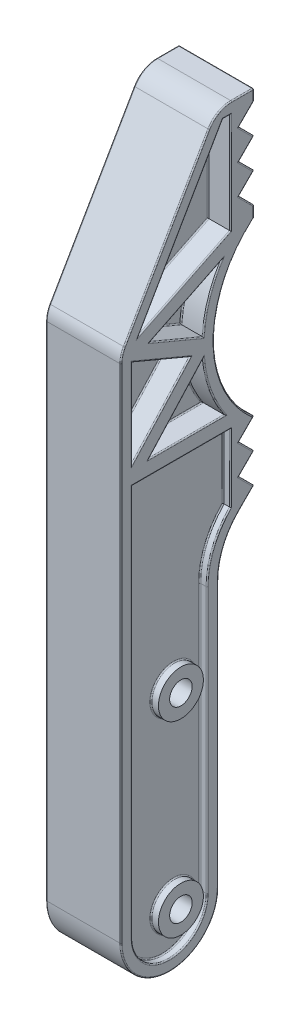
from build123d import *

# Parameters (mm, degrees)
SKETCH1_R           = 1.5000000000000004
SKETCH1_R_2         = 1.5000000000000009
BOSS_EXTRUDE1_DEPTH = 5
CUT_EXTRUDE1_DEPTH  = 2.5
CUT_EXTRUDE2_DEPTH  = 1
SKETCH4_R           = 3.000000000000001
SKETCH4_R_2         = 1.5000000000000009
SKETCH4_R_3         = 1.5000000000000007
EXTRUDE_THIN1_DEPTH = 1
CUT_EXTRUDE3_DEPTH  = 2
EXTRUDE_THIN2_REACH = 94.277
BOSS_EXTRUDE2_DEPTH = 3
FILLET1_R           = 3.5
FILLET2_R           = 0.15


with BuildPart() as part:
    # Sketch1 → Boss-Extrude1 (new, symmetric)
    with BuildSketch(Plane(origin=(0, 0, 0), x_dir=(0, 0, -1), z_dir=(1, 0, 0))):
        with BuildLine():
            Line((-9.2157e-13, 88.5), (-2.0000000000009006, 86.49999999999997))
            Line((-2.0000000000009006, 86.49999999999997), (-8.7992e-13, 84.49999999999999))
            Line((-8.7992e-13, 84.49999999999999), (-1.999999999999958, 82.49999999999999))
            Line((-1.999999999999958, 82.49999999999999), (-8.3826e-13, 80.49999999999999))
            Line((-8.3826e-13, 80.49999999999999), (-1.9999999999999163, 78.49999999999999))
            Line((-1.9999999999999163, 78.49999999999999), (8.331e-14, 76.49999999999999))
            Line((8.331e-14, 76.49999999999999), (-7.8099e-13, 75))
            ThreePointArc((-7.8099e-13, 75), (-5.309927760847989, 63.54999999999967), (8.331e-14, 52.10000000000001))
            Line((8.331e-14, 52.10000000000001), (-1.9999999999999163, 50.10000000000001))
            Line((-1.9999999999999163, 50.10000000000001), (-8.3826e-13, 48.1))
            Line((-8.3826e-13, 48.1), (-1.999999999999958, 46.1))
            Line((-1.999999999999958, 46.1), (-8.7992e-13, 44.1))
            Line((-8.7992e-13, 44.1), (-2.0000000000009006, 42.10000000000002))
            ThreePointArc((-2.0000000000009006, 42.10000000000002), (-4.035298285696316, 39.05396085688495), (-4.74999999999999, 35.46091270347603))
            Line((-4.74999999999999, 35.46091270347603), (-4.749999999999991, 0))
            ThreePointArc((-4.749999999999991, 0), (-11.249999999999993, -6.500000000000009), (-17.75, 0))
            Line((-17.75, 0), (-17.75, 67.91635220349649))
            Line((-17.75, 67.91635220349649), (-5, 89.99999999999997))
            Line((-5, 89.99999999999997), (0, 90))
            Line((0, 90), (-9.2157e-13, 88.5))
        make_face()
        with Locations((-9.749999999999991, 0)):
            Circle(SKETCH1_R, mode=Mode.SUBTRACT)
        with Locations((-9.749999999999991, 25)):
            Circle(SKETCH1_R_2, mode=Mode.SUBTRACT)
    extrude(amount=BOSS_EXTRUDE1_DEPTH, both=True)

    # Sketch2 → Cut-Extrude1 (cut, symmetric)
    with BuildSketch(Plane(origin=(0, 0, 0), x_dir=(0, 0, -1), z_dir=(1, 0, 0))):
        with BuildLine():
            Line((-4.750000000000018, -8.410797367107728), (-15.000000000000018, -8.41079736710773))
            Line((-15.000000000000018, -8.41079736710773), (-15.000000000000018, 23.589202632892267))
            ThreePointArc((-15.000000000000018, 23.589202632892267), (-12.082951062292494, 31.431396203571325), (-4.750000000000023, 35.46091270347603))
            Line((-4.750000000000023, 35.46091270347603), (-4.750000000000018, -8.410797367107728))
        make_face()
    cut_extrude1 = extrude(amount=CUT_EXTRUDE1_DEPTH, both=True, mode=Mode.SUBTRACT)

    # Sketch3 → Cut-Extrude2 (cut)
    with BuildSketch(Plane(origin=(5, 0, 0), x_dir=(0, 0, -1), z_dir=(1, 0, 0))):
        with BuildLine():
            Line((-3.1276474698880508, 88.49999999999997), (-4.133974596215556, 88.49999999999997))
            Line((-4.133974596215556, 88.49999999999997), (-16.249999999999996, 67.5144284148498))
            Line((-16.249999999999996, 67.5144284148498), (-16.249999999999993, 0))
            ThreePointArc((-16.249999999999993, 0), (-11.249999999999991, -5.000000000000002), (-6.2499999999999885, 2.8e-16))
            Line((-6.2499999999999885, 6.1e-16), (-6.250000000000024, 35.46091270347603))
            ThreePointArc((-6.250000000000028, 35.46091270347603), (-5.439227915646391, 39.58399221222367), (-3.1276474698880605, 43.093084951238914))
            Line((-3.127647469888051, 43.09308495123891), (-3.127647469887685, 53.159809363611274))
            ThreePointArc((-3.1276474698874654, 53.15980936361145), (-6.809927760847852, 63.54999999999947), (-3.1276474698881316, 73.94019063638773))
            Line((-3.1276474698881, 73.9401906363877), (-3.1276474698880508, 88.49999999999997))
        make_face()
    cut_extrude2 = extrude(amount=-CUT_EXTRUDE2_DEPTH, mode=Mode.SUBTRACT)

    # Sketch4 → Extrude-Thin1 (add)
    # profile 1 of 2: a face of its own
    with BuildSketch(Plane(origin=(4, 0, 0), x_dir=(0, 0, -1), z_dir=(1, 0, 0))):
        with Locations((-9.749999999999991, 25)):
            Circle(SKETCH4_R)
        with Locations((-9.749999999999991, 25)):
            Circle(SKETCH4_R_2, mode=Mode.SUBTRACT)
    # profile 2 of 2: a face of its own
    with BuildSketch(Plane(origin=(4, 0, 0), x_dir=(0, 0, -1), z_dir=(1, 0, 0))):
        with Locations((-9.749999999999991, 0)):
            Circle(SKETCH4_R)
        with Locations((-9.749999999999991, 0)):
            Circle(SKETCH4_R_3, mode=Mode.SUBTRACT)
    extrude_thin1 = extrude(amount=EXTRUDE_THIN1_DEPTH)

    # Sketch5 → Cut-Extrude3 (cut)
    with BuildSketch(Plane(origin=(4, 0, 0), x_dir=(0, 0, -1), z_dir=(1, 0, 0))):
        with BuildLine():
            Line((-16.24999999999999, 53.15980936361218), (-3.127647469888051, 53.159809363612176))
            ThreePointArc((-3.1276474698880516, 53.15980936361218), (-6.809927760847845, 63.55), (-3.1276474698880534, 73.94019063638781))
            Line((-3.127647469888053, 73.94019063638781), (-3.1276474698880508, 88.49999999999997))
            Line((-3.1276474698880508, 88.49999999999997), (-4.133974596215556, 88.49999999999997))
            Line((-4.133974596215556, 88.49999999999997), (-16.249999999999986, 67.5144284148498))
            Line((-16.249999999999986, 67.5144284148498), (-16.249999999999986, 53.15980936361218))
        make_face()
    cut_extrude3 = extrude(amount=-CUT_EXTRUDE3_DEPTH, mode=Mode.SUBTRACT)

    # Sketch6 → Extrude-Thin2 (add, up to next)
    with BuildSketch(Plane(origin=(5, 0, 0), x_dir=(0, 0, -1), z_dir=(1, 0, 0)), mode=Mode.PRIVATE) as extrude_thin2_sk1:
        Polygon((-3.1276474698880508, 54.159809363612176), (-13.990342612238493, 54.15980936361218), (-5.118699881032105, 63.92435955983372), (-13.833587800383937, 67.58424143620512), (-2.687863510147899, 73.04208704060653), (-3.5674314296282015, 74.83829423216909), (-18.666412199616058, 67.44461539349449), (-8.50115564066358, 63.175640440166276), (-18.5096573877615, 52.15980936361218), (-3.1276474698880516, 52.159809363612176), align=None)
    extrude_thin2_tool1 = extrude(extrude_thin2_sk1.sketch, amount=-EXTRUDE_THIN2_REACH, mode=Mode.PRIVATE) - part.part
    extrude_thin2 = extrude_thin2_tool1.solids().sort_by_distance((5, 53.882388, 8.558995))[0]
    add(extrude_thin2)

    # Sketch7 → Boss-Extrude2 (add)
    with BuildSketch(Plane(origin=(2, 0, 0), x_dir=(0, 0, -1), z_dir=(1, 0, 0))):
        Polygon((-3.567431429628199, 74.83829423216909), (-3.1276474698880494, 73.94019063638783), (-3.1276474698880508, 75.05364793095532), align=None)
    boss_extrude2 = extrude(amount=BOSS_EXTRUDE2_DEPTH)

    # Mirror1: Cut-Extrude1, Cut-Extrude2, Extrude-Thin1, Cut-Extrude3, Extrude-Thin2, Boss-Extrude2 across plane
    add(cut_extrude1.mirror(Plane(origin=(0, 0, 0), x_dir=(0, 0, 1), z_dir=(1, 0, 0))), mode=Mode.SUBTRACT)
    add(cut_extrude2.mirror(Plane(origin=(0, 0, 0), x_dir=(0, 0, 1), z_dir=(1, 0, 0))), mode=Mode.SUBTRACT)
    add(extrude_thin1.mirror(Plane(origin=(0, 0, 0), x_dir=(0, 0, 1), z_dir=(1, 0, 0))))
    add(cut_extrude3.mirror(Plane(origin=(0, 0, 0), x_dir=(0, 0, 1), z_dir=(1, 0, 0))), mode=Mode.SUBTRACT)
    add(extrude_thin2.mirror(Plane(origin=(0, 0, 0), x_dir=(0, 0, 1), z_dir=(1, 0, 0))))
    add(boss_extrude2.mirror(Plane(origin=(0, 0, 0), x_dir=(0, 0, 1), z_dir=(1, 0, 0))))

    # Fillet1
    fillet1_edges = [part.edges().sort_by_distance(p)[0] for p in [
        (0, 67.91635220349649, 17.75),
        (0, 89.99999999999997, 5),
    ]]
    fillet(fillet1_edges, radius=FILLET1_R)

    # Fillet2
    fillet2_edges = [part.edges().sort_by_distance(p)[0] for p in [
        (4, 25, 12.749999999999993),
        (4, 3.7e-16, 12.749999999999993),
        (2, 78.78337765876361, 9.743869120542215),
        (2, 88.49999999999997, 3.6308110330518035),
        (2, 57.95760700227714, 5.833301767777529),
        (2, 68.57604316622792, 6.025807949090991),
        (2, 60.53836023280243, 16.249999999999986),
        (5, 60.538360232802425, 16.249999999999996),
        (5, 26.07990468180609, 16.249999999999993),
        (4, 26.07990468180609, 16.249999999999993),
        (5, 47.626447157425545, 3.127647469887886),
        (4, 47.626447157425545, 3.127647469887886),
        (5, 68.57604316622819, 6.025807949090913),
        (5, 57.95760700227686, 5.833301767777433),
        (5, -6.500000000000008, 11.249999999999996),
        (2, 69.90851178522759, 9.087085542188174),
        (1.9999999999999996, 66.10212944744826, 10.304391967771537),
        (2, 58.145037974506735, 10.369538404409294),
        (2, 54.159809363612176, 8.933834763696728),
        (4, 52.15980936361218, 9.688823734944023),
        (5, 52.159809363612176, 9.688823734944023),
        (2, 58.911267876824816, 12.375577820331786),
        (5, 58.91126787682481, 12.37557782033179),
        (2, 64.80273279614389, 12.375577820331785),
        (5, 64.80273279614389, 12.375577820331792),
        (5, 72.06020162424129, 9.240705557378469),
        (2, 72.06020162424129, 9.240705557378465),
        (5, 54.15980936361218, 8.933834763696513),
        (5, 58.1450379745067, 10.369538404409326),
        (5, 66.10212944744829, 10.304391967771608),
        (5, 69.90851178522765, 9.087085542188046),
        (-5, 89.25, 4.6078e-13),
        (-5, 87.49999999999999, 1.000000000000911),
        (-5, 85.49999999999997, 1.0000000000008902),
        (-5, 83.49999999999999, 1.000000000000419),
        (2, 81.77682396547765, 3.1276474698880516),
        (5, 17.730456351738017, 4.749999999999991),
        (-5, 81.49999999999999, 1.0000000000003981),
        (-5, 79.49999999999999, 1.0000000000003773),
        (-5, 77.49999999999999, 0.9999999999999165),
        (-5, 75.75, 3.4884e-13),
        (-5, 63.549999999999805, 5.309927760847991),
        (-5, 51.10000000000001, 0.9999999999999165),
        (-5, 49.10000000000001, 1.0000000000003773),
        (-5, 47.1, 1.0000000000003981),
        (-5, 88.49999999999997, 3.6308110330518035),
        (-5, 78.78337765876361, 9.743869120542222),
        (-5, -5.000000000000001, 11.24999999999999),
        (-5, 17.730456351738017, 6.250000000000006),
        (-4, 39.58399221222367, 5.439227915646392),
        (-5, 45.1, 1.000000000000419),
        (-4, -5.000000000000001, 11.24999999999999),
        (-4, 17.730456351738017, 6.250000000000006),
        (-5, 39.58399221222367, 5.439227915646392),
        (-5, 81.77682396547765, 3.1276474698880734),
        (-5, 43.10000000000001, 1.0000000000008904),
        (5, 39.053960856884956, 4.0352982856963155),
        (-5, 39.053960856884956, 4.0352982856963155),
        (-5, 17.730456351738017, 4.749999999999991),
        (-5, -6.500000000000008, 11.249999999999996),
        (-4, 25, 12.749999999999993),
        (-4, 3.7e-16, 12.749999999999993),
        (-5, 89.99999999999999, 1.4896370289181577),
        (-2, 88.49999999999997, 3.6308110330518035),
        (-2, 78.78337765876361, 9.743869120542216),
        (5, 43.10000000000001, 1.0000000000008904),
        (-2, 60.53836023280243, 16.249999999999986),
        (-2, 57.95760700227714, 5.833301767777529),
        (-2, 68.57604316622792, 6.025807949090991),
        (-4, 47.626447157425545, 3.127647469887886),
        (-4, 26.07990468180609, 16.249999999999993),
        (-5, 47.626447157425545, 3.127647469887886),
        (-5, 60.538360232802425, 16.249999999999996),
        (-5, 26.07990468180609, 16.249999999999993),
        (-5, 68.57604316622819, 6.025807949090913),
        (-5, 57.95760700227686, 5.833301767777433),
        (-2, 72.06020162424129, 9.240705557378465),
        (-2, 64.80273279614389, 12.375577820331785),
        (-2, 58.911267876824816, 12.375577820331786),
        (-4, 52.15980936361218, 9.688823734944023),
        (-2, 54.159809363612176, 8.933834763696728),
        (-5, 54.15980936361218, 8.933834763696513),
        (-2, 58.145037974506735, 10.369538404409294),
        (-5, 58.1450379745067, 10.369538404409326),
        (-1.9999999999999996, 66.10212944744826, 10.304391967771537),
        (-5, 66.10212944744829, 10.304391967771608),
        (-2, 69.90851178522759, 9.087085542188174),
        (-5, 69.90851178522765, 9.087085542188046),
        (-5, 52.159809363612176, 9.688823734944023),
        (-5, 58.91126787682481, 12.37557782033179),
        (-5, 64.80273279614389, 12.375577820331792),
        (-5, 72.06020162424129, 9.240705557378469),
        (5, 45.1, 1.000000000000419),
        (0, 90, 0),
        (-2, 81.77682396547765, 3.1276474698880516),
        (-5, 78.48926501499376, 11.64572594216369),
        (5, 78.48926501499376, 11.64572594216369),
        (-5, 33.489265014993784, 17.75),
        (-5, 67.88439668784638, 17.63074039201174),
        (-5, 89.53108891324551, 4.729274057836312),
        (5, 33.489265014993784, 17.75),
        (5, 67.88439668784638, 17.63074039201174),
        (5, 89.53108891324551, 4.729274057836312),
        (5, 47.1, 1.0000000000003981),
        (5, 49.10000000000001, 1.0000000000003773),
        (5, 51.10000000000001, 0.9999999999999165),
        (5, 63.549999999999805, 5.309927760847991),
        (5, 89.99999999999999, 1.4896370289181577),
        (5, 75.75, 3.4884e-13),
        (5, 77.49999999999999, 0.9999999999999165),
        (5, 79.49999999999999, 1.0000000000003773),
        (5, 81.49999999999999, 1.0000000000003981),
        (5, 83.49999999999999, 1.000000000000419),
        (5, 85.49999999999997, 1.0000000000008902),
        (5, 87.49999999999999, 1.000000000000911),
        (5, 89.25, 4.6078e-13),
        (5, 39.58399221222367, 5.439227915646392),
        (4, 17.730456351738017, 6.250000000000006),
        (4, -5.000000000000001, 11.24999999999999),
        (5, 81.77682396547765, 3.1276474698880734),
        (4, 39.58399221222367, 5.439227915646392),
        (5, 88.49999999999997, 3.6308110330518035),
        (5, 78.78337765876361, 9.743869120542222),
        (5, -5.000000000000001, 11.24999999999999),
        (5, 17.730456351738017, 6.250000000000006),
    ]]
    fillet(fillet2_edges, radius=FILLET2_R - 0.0001)  # a hair under: the kernel refuses the full size


solid = part.part
